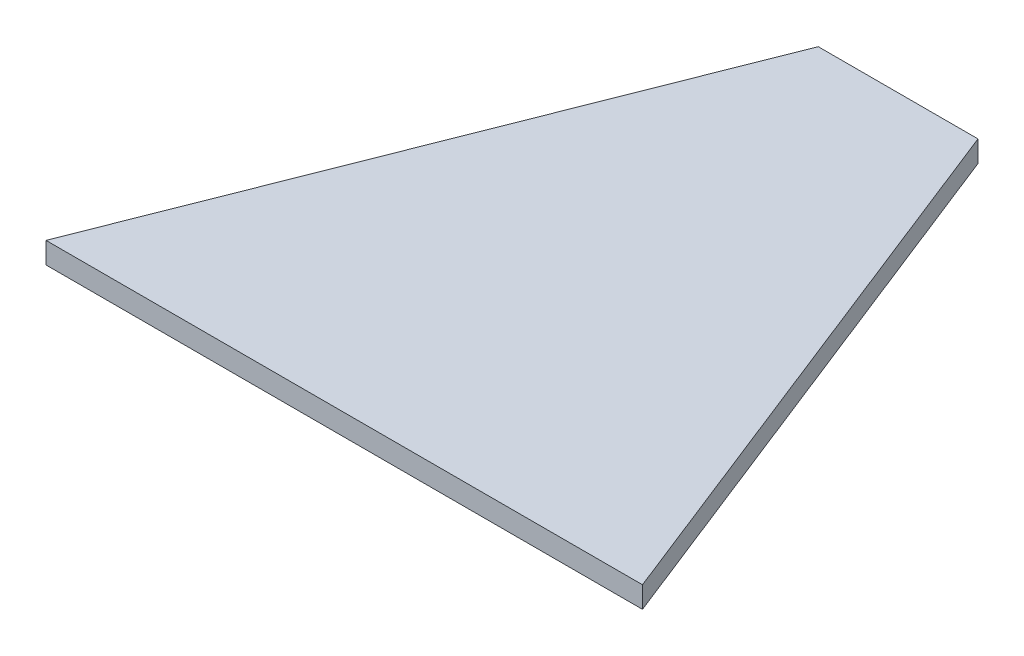
from build123d import *

# Parameters (mm, degrees)
SM_BASE_FLANGE_1_DEPTH = 4


# Sheet-metal steps are written as plain solids
with BuildPart() as part:
    # Sketch 1 → Базовая кромка1 (new body)
    with BuildSketch(Plane(origin=(0, 0, 0), x_dir=(1, 0, 0), z_dir=(0, 1, 0))):
        Polygon((-56, 0), (56, 0), (15, 104), (-15, 104), align=None)
    extrude(amount=SM_BASE_FLANGE_1_DEPTH)


solid = part.part
